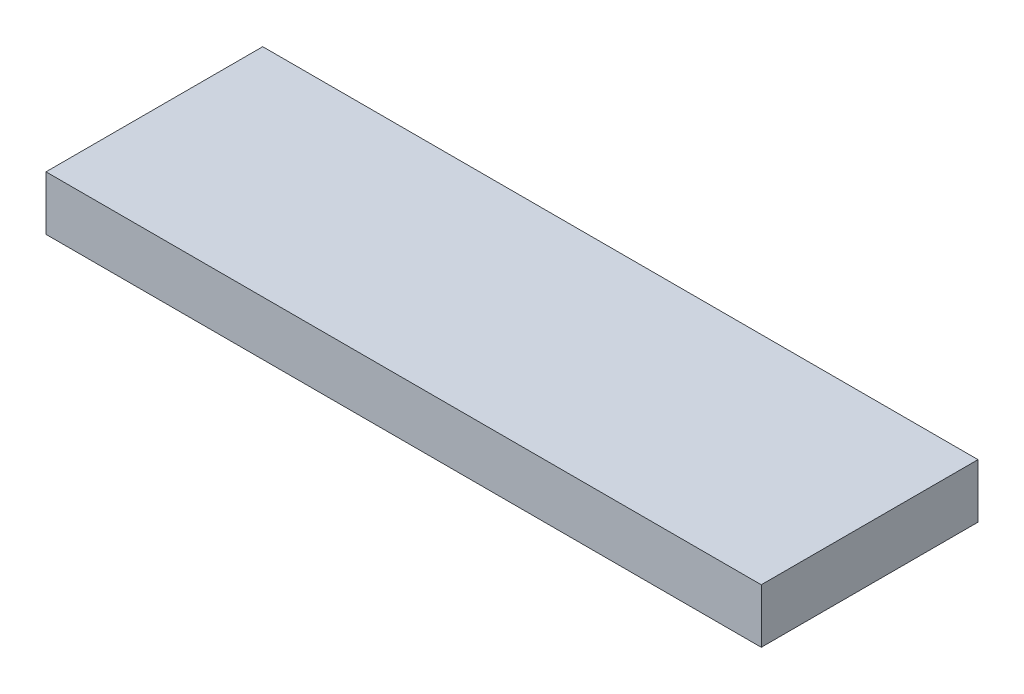
from build123d import *

# Parameters (mm, degrees)
SKETCH1_W = 83.82
SKETCH1_H = 25.4
BOX_DEPTH = 6.35


with BuildPart() as part:
    # Sketch1 → Box (new body)
    with BuildSketch(Plane(origin=(0, 0, 0), x_dir=(1, 0, 0), z_dir=(0, 1, 0))):
        Rectangle(SKETCH1_W, SKETCH1_H)
    extrude(amount=BOX_DEPTH)


solid = part.part
